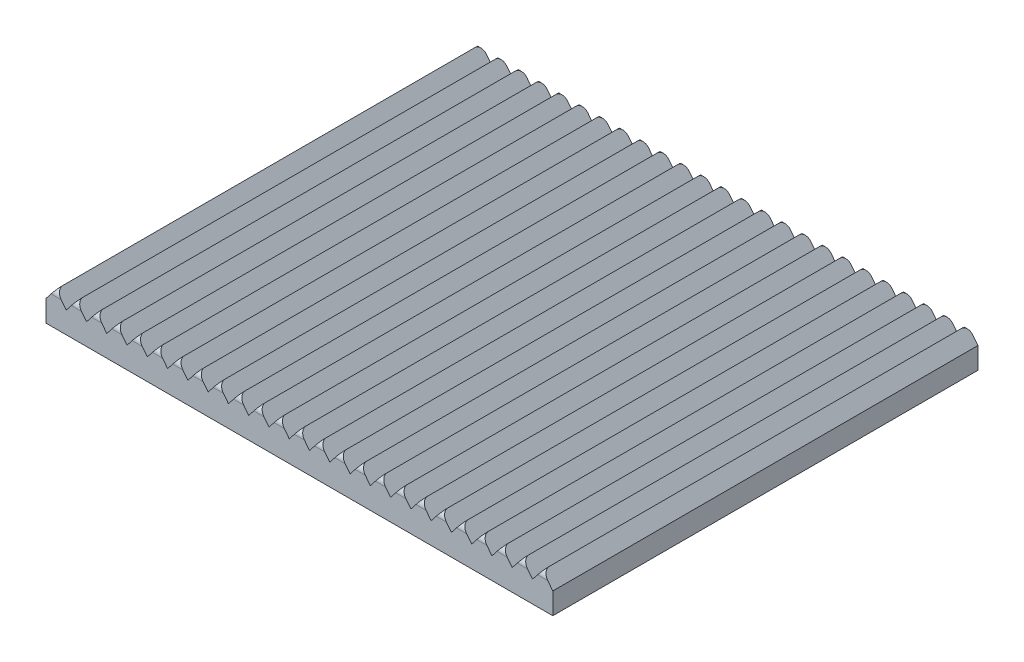
from build123d import *

# Parameters (mm, degrees)
SKETCH1_W           = 59
SKETCH1_H           = 49.5
SKETCH1_R           = 3
BOSS_EXTRUDE1_DEPTH = 1.5
BOSS_EXTRUDE2_DEPTH = 49.5
CUT_EXTRUDE1_DEPTH  = 2
CUT_EXTRUDE3_DEPTH  = 65.105869466
CHAMFER3_SIZE       = 2


with BuildPart() as part:
    # Sketch1 → Boss-Extrude1 (new body)
    with BuildSketch(Plane(origin=(0, 0, 0), x_dir=(1, 0, 0), z_dir=(0, 1, 0))):
        Rectangle(SKETCH1_W, SKETCH1_H)
        with Locations(Location((0, 0, 0), (0, 0, 270))):
            Circle(SKETCH1_R, mode=Mode.SUBTRACT)
    extrude(amount=BOSS_EXTRUDE1_DEPTH)

    # Sketch2 → Boss-Extrude2 (add)
    with BuildSketch(Plane(origin=(0, 0, -24.75), x_dir=(-1, 0, 0), z_dir=(0, 0, -1))):
        Polygon((-29.5, 1.5), (29.5, 1.5), (29.5, 2.5), (28.32, 4), (27.14, 2.5), (25.96, 4), (24.78, 2.5), (23.6, 4), (22.42, 2.5), (21.24, 4), (20.06, 2.5), (18.88, 4), (17.7, 2.5), (16.52, 4), (15.34, 2.5), (14.16, 4), (12.98, 2.5), (11.8, 4), (10.62, 2.5), (9.44, 4), (8.26, 2.5), (7.08, 4), (5.9, 2.5), (4.72, 4), (3.54, 2.5), (2.36, 4), (1.18, 2.5), (0, 4), (-1.18, 2.5), (-2.36, 4), (-3.54, 2.5), (-4.72, 4), (-5.9, 2.5), (-7.08, 4), (-8.26, 2.5), (-9.44, 4), (-10.62, 2.5), (-11.8, 4), (-12.98, 2.5), (-14.16, 4), (-15.34, 2.5), (-16.52, 4), (-17.7, 2.5), (-18.88, 4), (-20.06, 2.5), (-21.24, 4), (-22.42, 2.5), (-23.6, 4), (-24.78, 2.5), (-25.96, 4), (-27.14, 2.5), (-28.32, 4), (-29.5, 2.5), align=None)
    extrude(amount=-BOSS_EXTRUDE2_DEPTH)

    # Sketch3 → Cut-Extrude1 (cut)
    with BuildSketch(Plane(origin=(0, 0, 0), x_dir=(-1, 0, 0), z_dir=(0, -1, 0))):
        with BuildLine():
            Line((-1.75, -2.436698586), (-1.75, -5))
            Line((-1.75, -5), (1.75, -5))
            Line((1.75, -5), (1.75, -2.436698586))
            ThreePointArc((1.75, -2.436698586), (0, 3), (-1.75, -2.436698586))
        make_face()
    extrude(amount=-CUT_EXTRUDE1_DEPTH, mode=Mode.SUBTRACT)

    # Sketch4 → Cut-Extrude3 (cut, through all)
    with BuildSketch(Plane(origin=(29.5, 0, 0), x_dir=(0, 0, -1), z_dir=(1, 0, 0))):
        with BuildLine():
            Line((-24, 4), (-24.75, 4))
            Line((-24.75, 4), (-24.75, 3.25))
            ThreePointArc((-24.75, 3.25), (-24.530330086, 3.780330086), (-24, 4))
        make_face()
    cut_extrude3 = extrude(amount=-CUT_EXTRUDE3_DEPTH, mode=Mode.SUBTRACT)

    # Mirror1: Cut-Extrude3 across plane
    add(cut_extrude3.mirror(Plane.XY), mode=Mode.SUBTRACT)

    # Chamfer3
    chamfer3_edges = [part.edges().sort_by_distance(p)[0] for p in [
        (0, 0, 5),
    ]]
    chamfer(chamfer3_edges, length=CHAMFER3_SIZE - 0.0001)  # a hair under: the kernel refuses the full size


solid = part.part
